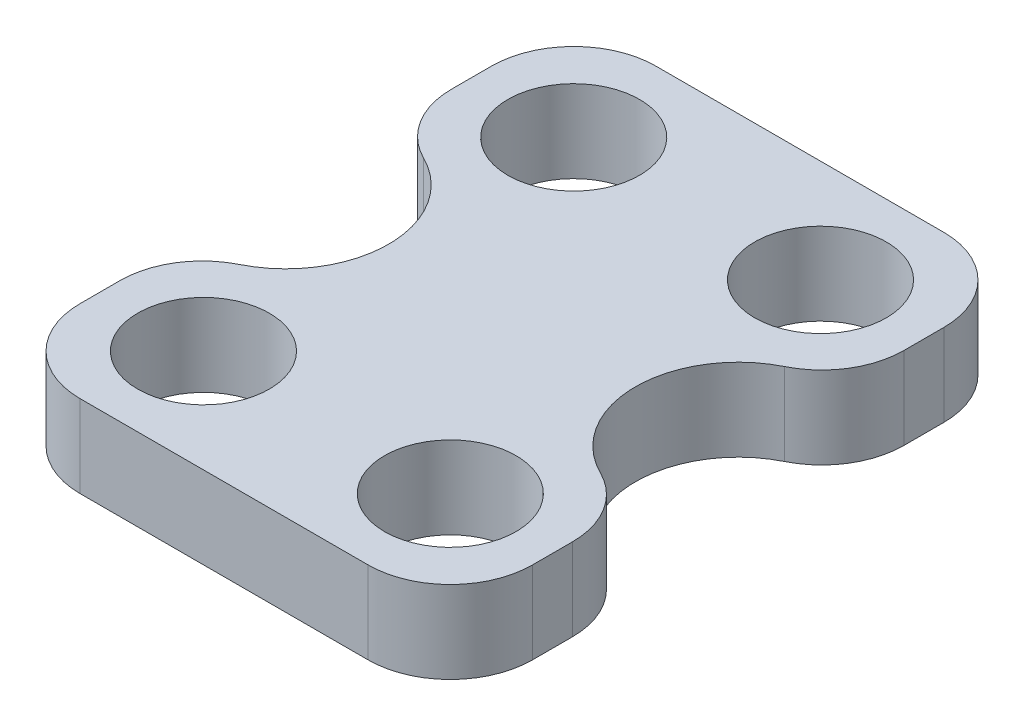
from build123d import *

# Parameters (mm, degrees)
SKETCH1_W           = 11
SKETCH1_H           = 14
SKETCH1_R           = 1.6
BOSS_EXTRUDE1_DEPTH = 2
FILLET1_R           = 2
SKETCH2_R           = 2.5
CUT_EXTRUDE1_DEPTH  = 15.439529078
FILLET2_R           = 2


with BuildPart() as part:
    # Sketch1 → Boss-Extrude1 (new body)
    with BuildSketch(Plane(origin=(0, 0, 0), x_dir=(1, 0, 0), z_dir=(0, 1, 0))):
        with Locations((3, -4.5)):
            Rectangle(SKETCH1_W, SKETCH1_H)
        Circle(SKETCH1_R, mode=Mode.SUBTRACT)
        with Locations((6, 0)):
            Circle(SKETCH1_R, mode=Mode.SUBTRACT)
        with Locations((0, -9)):
            Circle(SKETCH1_R, mode=Mode.SUBTRACT)
        with Locations((6, -9)):
            Circle(SKETCH1_R, mode=Mode.SUBTRACT)
    extrude(amount=BOSS_EXTRUDE1_DEPTH)

    # Fillet1
    fillet1_edges = [part.edges().sort_by_distance(p)[0] for p in [
        (-2.5, 1, 11.5),
        (8.5, 1, 11.5),
        (8.5, 1, -2.5),
        (-2.5, 1, -2.5),
    ]]
    fillet(fillet1_edges, radius=FILLET1_R)

    # Sketch2 → Cut-Extrude1 (cut, through all)
    with BuildSketch(Plane(origin=(0, 2, 0), x_dir=(1, 0, 0), z_dir=(0, 1, 0))):
        with Locations((-2.5, -4.5)):
            Circle(SKETCH2_R)
        with Locations((8.5, -4.5)):
            Circle(SKETCH2_R)
    extrude(amount=-CUT_EXTRUDE1_DEPTH, mode=Mode.SUBTRACT)

    # Fillet2
    fillet2_edges = [part.edges().sort_by_distance(p)[0] for p in [
        (-2.5, 1, 7),
        (8.5, 1, 7),
        (8.5, 1, 2),
        (-2.5, 1, 2),
    ]]
    fillet(fillet2_edges, radius=FILLET2_R)


solid = part.part
